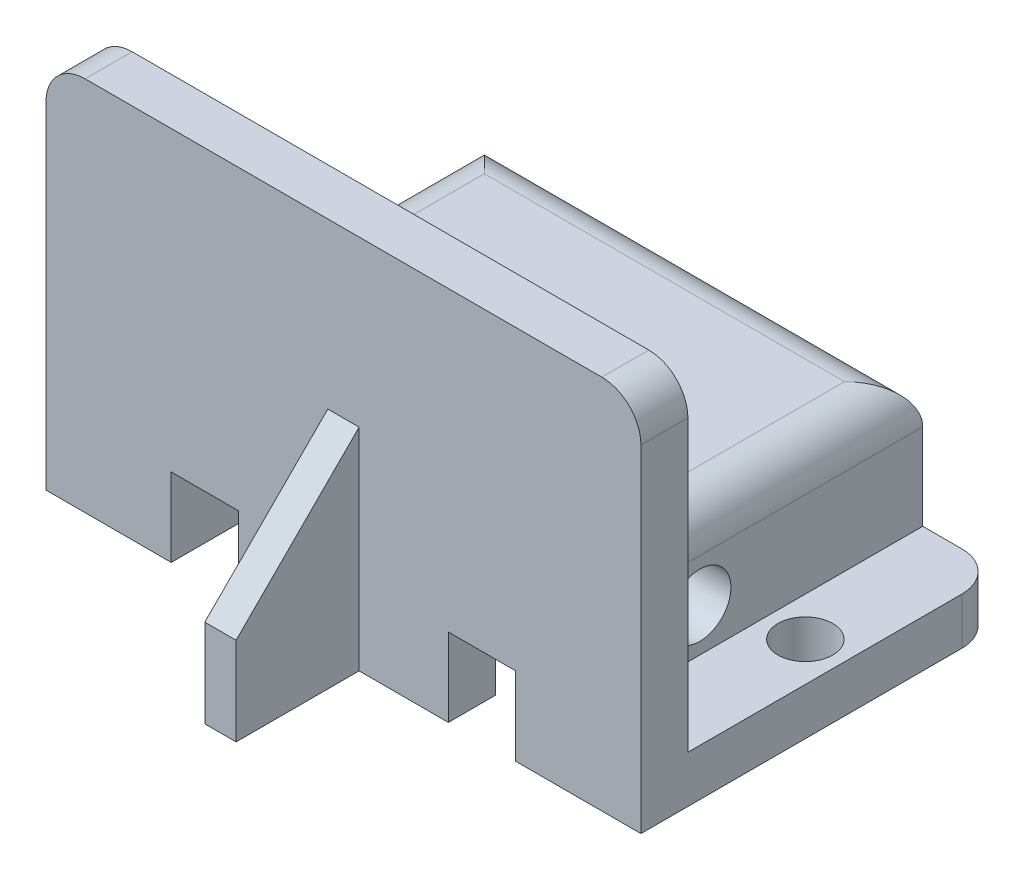
from build123d import *

# Parameters (mm, degrees)
SKETCH1_W           = 3
SKETCH1_H           = 24
BOSS_EXTRUDE1_DEPTH = 38
SKETCH2_W           = 2
SKETCH2_H           = 13.483919992
BOSS_EXTRUDE2_DEPTH = 20
CHAMFER1_SIZE       = 20
SKETCH3_W           = 38
SKETCH3_H           = 3
BOSS_EXTRUDE3_DEPTH = 20
SKETCH4_R           = 1.75
CUT_EXTRUDE1_DEPTH  = 51.487622245
SKETCH5_W           = 28
SKETCH5_H           = 20
BOSS_EXTRUDE4_DEPTH = 8
CUT_EXTRUDE2_DEPTH  = 8
SKETCH7_W           = 4.299558672
SKETCH7_H           = 5.002260433
CUT_EXTRUDE3_DEPTH  = 15
CUT_EXTRUDE4_DEPTH  = 15
FILLET3_R           = 2.5
SKETCH9_W           = 3
SKETCH9_H           = 10
BOSS_EXTRUDE5_DEPTH = 7.5
CHAMFER2_SIZE       = 7.5
FILLET4_R           = 2.5
SKETCH11_R          = 2
CUT_EXTRUDE5_DEPTH  = 47.840153715


# Some blends are built 0.0001 mm under size
with BuildPart() as part:
    # Sketch1 → Boss-Extrude1 (new body)
    with BuildSketch(Plane(origin=(0, 0, 0), x_dir=(0, 0, -1), z_dir=(1, 0, 0))):
        with Locations((1.5, 12)):
            Rectangle(SKETCH1_W, SKETCH1_H)
    extrude(amount=BOSS_EXTRUDE1_DEPTH)

    # Sketch2 → Boss-Extrude2 (add)
    with BuildSketch(Plane.XY):
        with Locations((19, 6.741959996)):
            Rectangle(SKETCH2_W, SKETCH2_H)
    extrude(amount=BOSS_EXTRUDE2_DEPTH)

    # Chamfer1
    # the kernel refuses this chamfer: 20 mm, written as the material it takes off along each edge
    with BuildSketch(Plane(origin=(71.433659759, 13.483919992, 20), x_dir=(0, 0.027495876610586403, -0.9996219169112968), z_dir=(-1, 0, 0))) as chamfer1_piece_1_section:
        Polygon((CHAMFER1_SIZE * 0.999621916911, CHAMFER1_SIZE * 0.0274958766106), (-CHAMFER1_SIZE * 0.0274958766106, CHAMFER1_SIZE * 0.999621916911), (0, 0), align=None)
    chamfer1_piece_1 = extrude(amount=104.867319519, mode=Mode.PRIVATE)
    chamfer1_piece_1 = split(chamfer1_piece_1, bisect_by=Plane(origin=(19, 6.875836906, 0), z_dir=(0, 0, 1)), keep=Keep.TOP, mode=Mode.PRIVATE)
    add(chamfer1_piece_1, mode=Mode.SUBTRACT)

    # Sketch3 → Boss-Extrude3 (add)
    with BuildSketch(Plane(origin=(0, 0, -3), x_dir=(-1, 0, 0), z_dir=(0, 0, -1))):
        with Locations((-19, 1.5)):
            Rectangle(SKETCH3_W, SKETCH3_H)
    extrude(amount=BOSS_EXTRUDE3_DEPTH)

    # Sketch4 → Cut-Extrude1 (cut, through all)
    with BuildSketch(Plane.XZ):
        with Locations(Location((2.5, -13, 0), (0, 0, 270))):
            Circle(SKETCH4_R)
        with Locations(Location((35.5, -13, 0), (0, 0, 270))):
            Circle(SKETCH4_R)
    extrude(amount=-CUT_EXTRUDE1_DEPTH, mode=Mode.SUBTRACT)

    # Sketch5 → Boss-Extrude4 (add)
    with BuildSketch(Plane(origin=(0, 3, 0), x_dir=(1, 0, 0), z_dir=(0, 1, 0))):
        with Locations((19, 13)):
            Rectangle(SKETCH5_W, SKETCH5_H)
    extrude(amount=BOSS_EXTRUDE4_DEPTH)

    # Sketch6 → Cut-Extrude2 (cut)
    with BuildSketch(Plane.XZ):
        Polygon((11, -23), (27, -23), (27, -20), (30, -20), (30, -3), (8, -3), (8, -20), (11, -20), align=None)
    extrude(amount=-CUT_EXTRUDE2_DEPTH, mode=Mode.SUBTRACT)

    # Sketch7 → Cut-Extrude3 (cut)
    with BuildSketch(Plane(origin=(0, 0, -3), x_dir=(-1, 0, 0), z_dir=(0, 0, -1))):
        with Locations((-27.850220664, 2.501130217)):
            Rectangle(SKETCH7_W, SKETCH7_H)
        with Locations((-10.149779336, 2.501130217)):
            Rectangle(SKETCH7_W, SKETCH7_H)
    extrude(amount=-CUT_EXTRUDE3_DEPTH, mode=Mode.SUBTRACT)

    # Sketch8 → Cut-Extrude4 (cut)
    with BuildSketch(Plane.ZY.offset(-18)):
        Polygon((7.858304832, 5.62561516), (7.858304832, 0), (13.483919992, 0), align=None)
    extrude(amount=-CUT_EXTRUDE4_DEPTH, mode=Mode.SUBTRACT)

    # Fillet3
    fillet3_edges = [part.edges().sort_by_distance(p)[0] for p in [
        (38, 1.5, -23),
        (0, 1.5, -23),
        (5, 7, -3),
        (33, 7, -3),
        (5, 11, -13),
        (19, 11, -3),
        (33, 11, -13),
        (19, 11, -23),
    ]]
    fillet(fillet3_edges, radius=FILLET3_R)

    # Sketch9 → Boss-Extrude5 (add)
    with BuildSketch(Plane(origin=(0, 11, 0), x_dir=(1, 0, 0), z_dir=(0, 1, 0))):
        with Locations((12.5, 8)):
            Rectangle(SKETCH9_W, SKETCH9_H)
        with Locations((25.5, 8)):
            Rectangle(SKETCH9_W, SKETCH9_H)
    extrude(amount=BOSS_EXTRUDE5_DEPTH)

    # Chamfer2
    chamfer2_edges = [part.edges().sort_by_distance(p)[0] for p in [
        (12.5, 18.5, -13),
        (25.5, 18.5, -13),
    ]]
    chamfer(chamfer2_edges, length=CHAMFER2_SIZE - 0.0001)  # a hair under: the kernel refuses the full size

    # Fillet4
    fillet4_edges = [part.edges().sort_by_distance(p)[0] for p in [
        (38, 24, -1.5),
        (0, 24, -1.5),
    ]]
    fillet(fillet4_edges, radius=FILLET4_R)

    # Sketch11 → Cut-Extrude5 (cut, through all)
    with BuildSketch(Plane(origin=(33, 0, 0), x_dir=(0, 0, -1), z_dir=(1, 0, 0))):
        with Locations((8.74878855, 5.75)):
            Circle(SKETCH11_R)
    extrude(amount=-CUT_EXTRUDE5_DEPTH, mode=Mode.SUBTRACT)


solid = part.part
